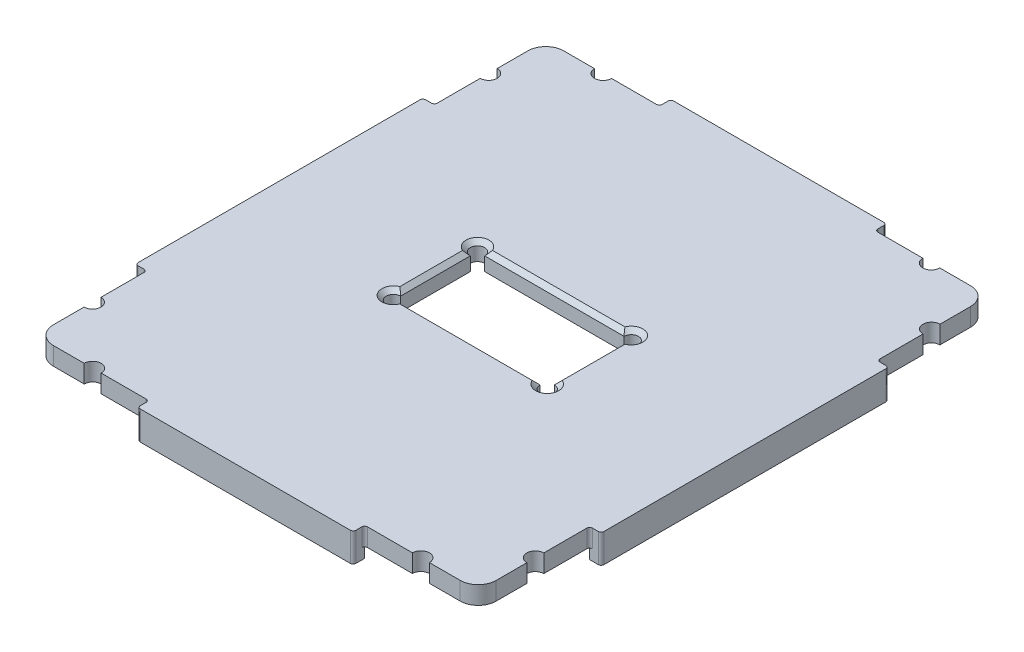
from build123d import *
from OCP.BRepAlgoAPI import BRepAlgoAPI_Cut
from OCP.TopTools import TopTools_ListOfShape

# Parameters (mm, degrees)
SKETCH1_W           = 78.232
SKETCH1_H           = 90.17
BOSS_EXTRUDE1_DEPTH = 3.175
FILLET1_R           = 3.175
SKETCH2_W           = 2.032
SKETCH2_H           = 50.8
SKETCH2_W_2         = 38.1
SKETCH2_H_2         = 2.032
BOSS_EXTRUDE2_DEPTH = 5.08
FILLET3_R           = 0.508
CUT_EXTRUDE1_DEPTH  = 63.761267046
CHAMFER2_SIZE       = 0.762


with BuildPart() as part:
    # Sketch1 → Boss-Extrude1 (new body)
    with BuildSketch(Plane(origin=(0, 0, 0), x_dir=(1, 0, 0), z_dir=(0, 1, 0))):
        Rectangle(SKETCH1_W, SKETCH1_H)
        with BuildLine():
            Line((-12.319, 7.493), (12.319, 7.493))
            ThreePointArc((12.319, 7.493), (14.487025612, 8.391025612), (13.589, 6.223))
            Line((13.589, 6.223), (13.589, -6.096))
            ThreePointArc((13.589, -6.096), (14.487025612, -8.264025612), (12.319, -7.366))
            Line((12.319, -7.366), (-12.319, -7.366))
            ThreePointArc((-12.319, -7.366), (-14.487025612, -8.264025612), (-13.589, -6.096))
            Line((-13.589, -6.096), (-13.589, 6.223))
            ThreePointArc((-13.589, 6.223), (-14.487025612, 8.391025612), (-12.319, 7.493))
        make_face(mode=Mode.SUBTRACT)
    extrude(amount=BOSS_EXTRUDE1_DEPTH)

    # Fillet1
    fillet1_edges = [part.edges().sort_by_distance(p)[0] for p in [
        (-39.116, 1.5875, -45.085),
        (39.116, 1.5875, -45.085),
        (39.116, 1.5875, 45.085),
        (-39.116, 1.5875, 45.085),
    ]]
    fillet(fillet1_edges, radius=FILLET1_R)


with BuildPart() as boss_extrude2_tool:
    # Sketch2 → Boss-Extrude2 (new body)
    with BuildSketch(Plane(origin=(0, 3.175, 0), x_dir=(1, 0, 0), z_dir=(0, 1, 0))):
        Polygon((19.049995564, -47.117005476), (19.049995755, -45.085005476), (-19.050004245, -45.085001889), (-19.050004436, -47.117001889), align=None)
        with Locations((-40.132001661, 0)):
            Rectangle(SKETCH2_W, SKETCH2_H)
        with Locations((0, 46.101)):
            Rectangle(SKETCH2_W_2, SKETCH2_H_2)
        with Locations((40.132001661, 0)):
            Rectangle(SKETCH2_W, SKETCH2_H)
    extrude(amount=-BOSS_EXTRUDE2_DEPTH)


with BuildPart() as part_1:
    add(part.part)


with BuildPart() as part_2:
    # Boss-Extrude2: joined with boss_extrude2_tool
    add(part_1.part.fuse(boss_extrude2_tool.part, tol=0.00001))

    # Fillet3
    fillet3_edges = [part_2.edges().sort_by_distance(p)[0] for p in [
        (-39.116001661, 1.5875, 25.4),
        (-41.148001661, 0.635, 25.4),
        (-41.148001661, 0.635, -25.4),
        (-39.116001661, 1.5875, -25.4),
        (-19.05, 0.635, -47.117),
        (-19.05, 1.5875, -45.085),
        (19.05, 0.635, -47.117),
        (19.05, 1.5875, -45.085),
        (39.116001661, 1.5875, -25.4),
        (41.148001661, 0.635, -25.4),
        (41.148001661, 0.635, 25.4),
        (39.116001661, 1.5875, 25.4),
        (19.049995564, 0.635, 47.117005476),
        (19.049995755, 1.5875, 45.085005476),
        (-19.050004436, 0.635, 47.117001889),
        (-19.050004245, 1.5875, 45.085001889),
    ]]
    fillet(fillet3_edges, radius=FILLET3_R)


with BuildPart() as cut_extrude1_tool:
    # Sketch3 → Cut-Extrude1 (new, through all)
    with BuildSketch(Plane(origin=(0, 3.175, 0), x_dir=(1, 0, 0), z_dir=(0, 1, 0))):
        with BuildLine():
            Line((-39.116, 36.5), (-39.116, 33.5))
            ThreePointArc((-39.116, 33.5), (-37.616, 35), (-39.116, 36.5))
        make_face()
        with BuildLine():
            Line((-27.5, 45.085), (-30.5, 45.085))
            ThreePointArc((-30.5, 45.085), (-29, 43.585), (-27.5, 45.085))
        make_face()
        with BuildLine():
            Line((27.499999809, 45.084997268), (30.499999809, 45.084997268))
            ThreePointArc((30.499999809, 45.084997268), (28.999999809, 43.584997268), (27.499999809, 45.084997268))
        make_face()
        with BuildLine():
            Line((39.115998859, 36.499996315), (39.115998859, 33.499996315))
            ThreePointArc((39.115998859, 33.499996315), (37.615998859, 34.999996315), (39.115998859, 36.499996315))
        make_face()
        with BuildLine():
            Line((39.115998859, -33.499996315), (39.115998859, -36.499996315))
            ThreePointArc((39.115998859, -36.499996315), (37.615998859, -34.999996315), (39.115998859, -33.499996315))
        make_face()
        with BuildLine():
            Line((30.499999809, -45.084997268), (27.499999809, -45.084997268))
            ThreePointArc((27.499999809, -45.084997268), (28.999999809, -43.584997268), (30.499999809, -45.084997268))
        make_face()
        with BuildLine():
            Line((-27.5, -45.085), (-30.5, -45.085))
            ThreePointArc((-30.5, -45.085), (-29, -43.585), (-27.5, -45.085))
        make_face()
        with BuildLine():
            Line((-39.116, -36.5), (-39.116, -33.5))
            ThreePointArc((-39.116, -33.5), (-37.616, -35), (-39.116, -36.5))
        make_face()
    extrude(amount=-CUT_EXTRUDE1_DEPTH)


with BuildPart() as part_3:
    add(part_2.part)

    # Cut-Extrude1: cut by cut_extrude1_tool, with a tolerance
    cut_extrude1_stock = TopTools_ListOfShape()
    cut_extrude1_stock.Append(part_3.part.wrapped)
    cut_extrude1_tools = TopTools_ListOfShape()
    cut_extrude1_tools.Append(cut_extrude1_tool.part.wrapped)
    cut_extrude1_cut = BRepAlgoAPI_Cut()
    cut_extrude1_cut.SetArguments(cut_extrude1_stock)
    cut_extrude1_cut.SetTools(cut_extrude1_tools)
    cut_extrude1_cut.SetFuzzyValue(0.00001)
    cut_extrude1_cut.Build()
    add(Compound.cast(cut_extrude1_cut.Shape()).solids(), mode=Mode.REPLACE)

    # Chamfer2
    chamfer2_edges = [part_3.edges().sort_by_distance(p)[0] for p in [
        (-14.487025612, 3.175, 8.264025612),
        (0, 3.175, 7.366),
        (14.487025612, 3.175, 8.264025612),
        (13.589, 3.175, -0.0635),
        (14.487025612, 3.175, -8.391025612),
        (-13.589, 3.175, -0.0635),
        (-14.487025612, 3.175, -8.391025612),
        (0, 3.175, -7.493),
    ]]
    chamfer(chamfer2_edges, length=CHAMFER2_SIZE)


solid = part_3.part
